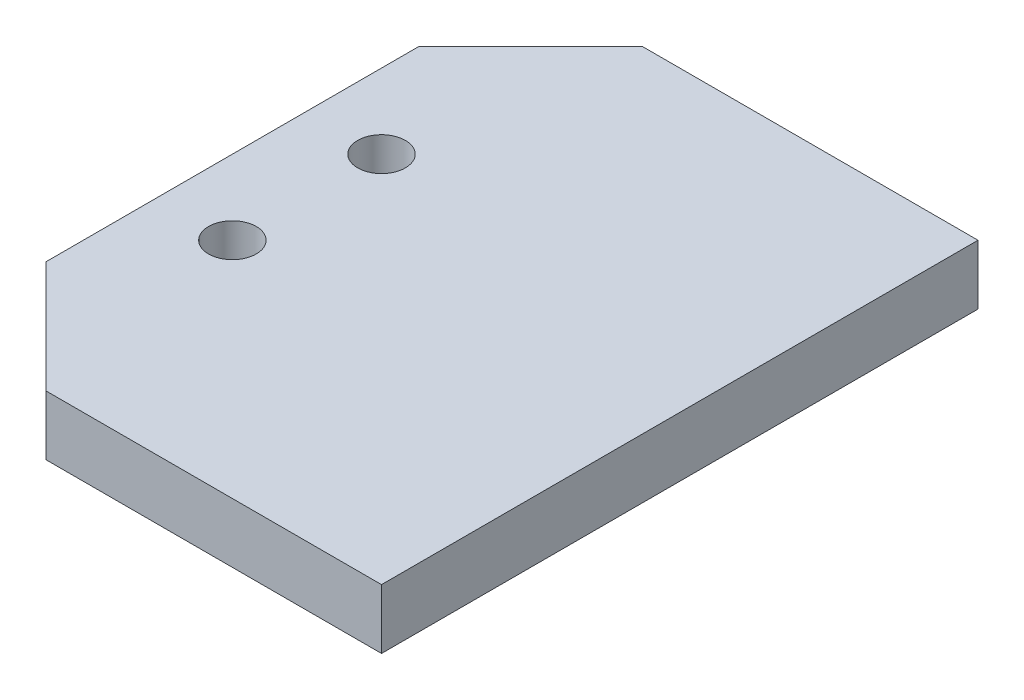
from build123d import *

# Parameters (mm, degrees)
SKETCH1_W           = 30
SKETCH1_H           = 40
SKETCH1_R           = 1.6
BOSS_EXTRUDE1_DEPTH = 4
CHAMFER1_SIZE       = 7.5


with BuildPart() as part:
    # Sketch1 → Boss-Extrude1 (new body)
    with BuildSketch(Plane(origin=(0, 0, 0), x_dir=(1, 0, 0), z_dir=(0, 1, 0))):
        with Locations((15, 20)):
            Rectangle(SKETCH1_W, SKETCH1_H)
        with Locations((5, 25)):
            Circle(SKETCH1_R, mode=Mode.SUBTRACT)
        with Locations((5, 15)):
            Circle(SKETCH1_R, mode=Mode.SUBTRACT)
    extrude(amount=BOSS_EXTRUDE1_DEPTH)

    # Chamfer1
    chamfer1_edges = [part.edges().sort_by_distance(p)[0] for p in [
        (0, 2, -40),
        (0, 2, 0),
    ]]
    chamfer(chamfer1_edges, length=CHAMFER1_SIZE)


solid = part.part
